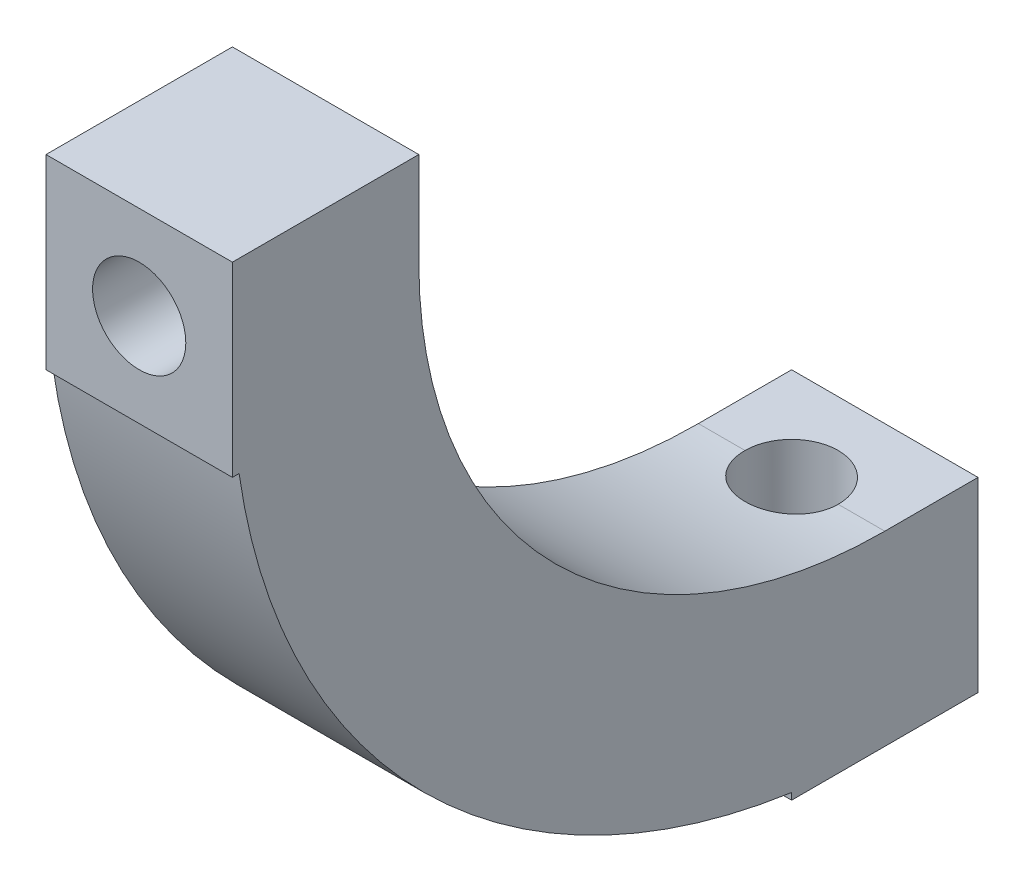
from build123d import *

# Parameters (mm, degrees)
BOSS_EXTRUDE1_DEPTH      = 3
BOSS_EXTRUDE1_DEPTH_BACK = 3
SKETCH7_R                = 1.5
CUT_EXTRUDE1_DEPTH       = 30.849623113
SKETCH8_R                = 1.5
CUT_EXTRUDE2_DEPTH       = 30.849623194


with BuildPart() as part:
    # Sketch5 → Boss-Extrude1 (new, two sides: drawn at the far end of the back side and taken through both)
    with BuildSketch(Plane(origin=(0, 0, 0), x_dir=(0, 0, -1), z_dir=(1, 0, 0)).offset(-BOSS_EXTRUDE1_DEPTH_BACK)):
        with BuildLine():
            Line((-21, 0), (-21, 3))
            Line((-21, 3), (-15, 3))
            Line((-15, 3), (-15, 0))
            ThreePointArc((-15, 0), (-10.606601718, -10.606601718), (0, -15))
            Line((0, -15), (3, -15))
            Line((3, -15), (3, -21))
            Line((3, -21), (0, -21))
            Line((0, -21), (-3, -21))
            Line((-3, -21), (-3, -20.784609691))
            ThreePointArc((-3, -20.784609691), (-14.849242405, -14.849242405), (-20.784609691, -3))
            Line((-20.784609691, -3), (-21, -3))
            Line((-21, -3), (-21, 0))
        make_face()
    extrude(amount=BOSS_EXTRUDE1_DEPTH + BOSS_EXTRUDE1_DEPTH_BACK)

    # Sketch7 → Cut-Extrude1 (cut, through all)
    with BuildSketch(Plane.XY):
        Circle(SKETCH7_R)
    extrude(amount=CUT_EXTRUDE1_DEPTH, mode=Mode.SUBTRACT)

    # Sketch8 → Cut-Extrude2 (cut, through all)
    with BuildSketch(Plane(origin=(0, 0, 0), x_dir=(1, 0, 0), z_dir=(0, 1, 0))):
        Circle(SKETCH8_R)
    extrude(amount=-CUT_EXTRUDE2_DEPTH, mode=Mode.SUBTRACT)


solid = part.part
